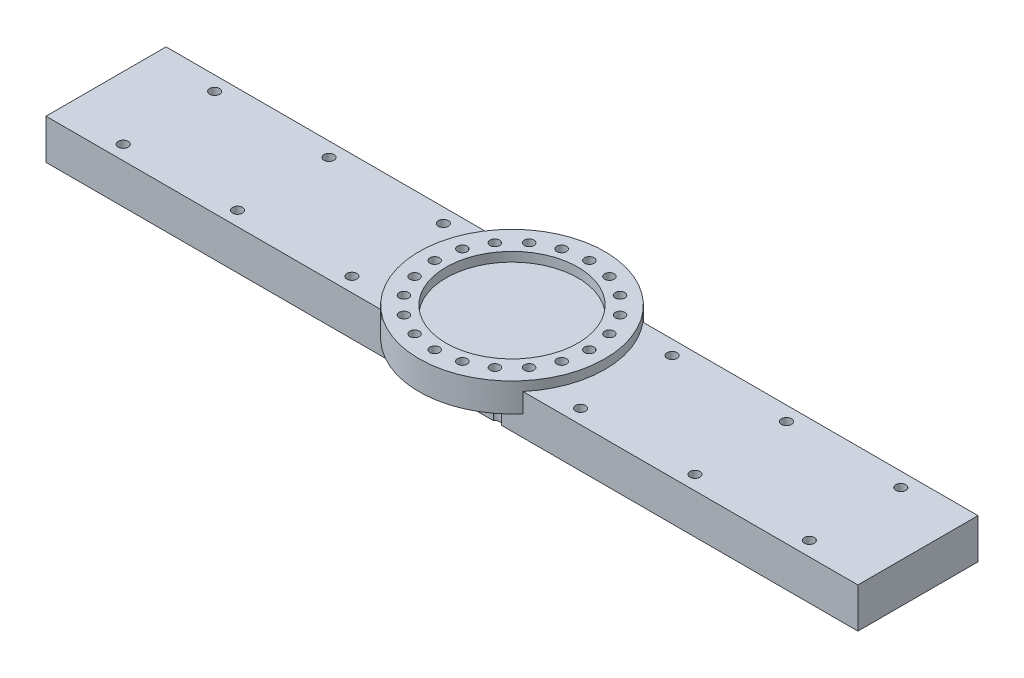
from build123d import *

# Parameters (mm, degrees)
SKETCH1_R                = 32.5
SKETCH1_R_2              = 1.675
BOSS_EXTRUDE1_DEPTH      = 10
SKETCH2_R                = 23.05
CUT_EXTRUDE1_DEPTH       = 3.25
BOSS_EXTRUDE2_DEPTH      = 7.25
BOSS_EXTRUDE2_DEPTH_BACK = 6.75
SKETCH3_W                = 284
SKETCH3_H                = 42
SKETCH3_R                = 1.75
CUT_EXTRUDE2_DEPTH       = 147.014554069
CUT_EXTRUDE2_DEPTH_BACK  = 147.014554069
SKETCH1_2_R              = 1.675


with BuildPart() as part:
    # Sketch1 → Boss-Extrude1 (new body)
    with BuildSketch(Plane(origin=(0, 0, 0), x_dir=(1, 0, 0), z_dir=(0, 1, 0))):
        Circle(SKETCH1_R)
        with Locations((15.899591075, 21.883909698)):
            Circle(SKETCH1_R_2, mode=Mode.SUBTRACT)
        with Locations((21.883909698, 15.899591075)):
            Circle(SKETCH1_R_2, mode=Mode.SUBTRACT)
        with Locations((25.726078766, 8.358909698)):
            Circle(SKETCH1_R_2, mode=Mode.SUBTRACT)
        with Locations((27.05, 0)):
            Circle(SKETCH1_R_2, mode=Mode.SUBTRACT)
        with Locations((25.726078766, -8.358909698)):
            Circle(SKETCH1_R_2, mode=Mode.SUBTRACT)
        with Locations((21.883909698, -15.899591075)):
            Circle(SKETCH1_R_2, mode=Mode.SUBTRACT)
        with Locations((15.899591075, -21.883909698)):
            Circle(SKETCH1_R_2, mode=Mode.SUBTRACT)
        with Locations((8.358909698, -25.726078766)):
            Circle(SKETCH1_R_2, mode=Mode.SUBTRACT)
        with Locations((0, -27.05)):
            Circle(SKETCH1_R_2, mode=Mode.SUBTRACT)
        with Locations((-8.358909698, -25.726078766)):
            Circle(SKETCH1_R_2, mode=Mode.SUBTRACT)
        with Locations((-15.899591075, -21.883909698)):
            Circle(SKETCH1_R_2, mode=Mode.SUBTRACT)
        with Locations((-21.883909698, -15.899591075)):
            Circle(SKETCH1_R_2, mode=Mode.SUBTRACT)
        with Locations((-25.726078766, -8.358909698)):
            Circle(SKETCH1_R_2, mode=Mode.SUBTRACT)
        with Locations((-27.05, 0)):
            Circle(SKETCH1_R_2, mode=Mode.SUBTRACT)
        with Locations((-25.726078766, 8.358909698)):
            Circle(SKETCH1_R_2, mode=Mode.SUBTRACT)
        with Locations((-21.883909698, 15.899591075)):
            Circle(SKETCH1_R_2, mode=Mode.SUBTRACT)
        with Locations((-15.899591075, 21.883909698)):
            Circle(SKETCH1_R_2, mode=Mode.SUBTRACT)
        with Locations((-8.358909698, 25.726078766)):
            Circle(SKETCH1_R_2, mode=Mode.SUBTRACT)
        with Locations((0, 27.05)):
            Circle(SKETCH1_R_2, mode=Mode.SUBTRACT)
        with Locations((8.358909698, 25.726078766)):
            Circle(SKETCH1_R_2, mode=Mode.SUBTRACT)
    extrude(amount=BOSS_EXTRUDE1_DEPTH)

    # Sketch2 → Cut-Extrude1 (cut)
    with BuildSketch(Plane(origin=(0, 10, 0), x_dir=(1, 0, 0), z_dir=(0, 1, 0))):
        Circle(SKETCH2_R)
    extrude(amount=-CUT_EXTRUDE1_DEPTH, mode=Mode.SUBTRACT)

    # Sketch3 → Boss-Extrude2 (add, two sides: drawn at the far end of the back side and taken through both)
    with BuildSketch(Plane.XZ.offset(-BOSS_EXTRUDE2_DEPTH_BACK)):
        Rectangle(SKETCH3_W, SKETCH3_H)
        with Locations((-120, 16)):
            Circle(SKETCH3_R, mode=Mode.SUBTRACT)
        with Locations((-80, 16)):
            Circle(SKETCH3_R, mode=Mode.SUBTRACT)
        with Locations((-40, 16)):
            Circle(SKETCH3_R, mode=Mode.SUBTRACT)
        with Locations((0, 16)):
            Circle(SKETCH3_R, mode=Mode.SUBTRACT)
        with Locations((40, 16)):
            Circle(SKETCH3_R, mode=Mode.SUBTRACT)
        with Locations((80, 16)):
            Circle(SKETCH3_R, mode=Mode.SUBTRACT)
        with Locations((120, 16)):
            Circle(SKETCH3_R, mode=Mode.SUBTRACT)
        with Locations((120, -16)):
            Circle(SKETCH3_R, mode=Mode.SUBTRACT)
        with Locations((80, -16)):
            Circle(SKETCH3_R, mode=Mode.SUBTRACT)
        with Locations((40, -16)):
            Circle(SKETCH3_R, mode=Mode.SUBTRACT)
        with Locations((0, -16)):
            Circle(SKETCH3_R, mode=Mode.SUBTRACT)
        with Locations((-40, -16)):
            Circle(SKETCH3_R, mode=Mode.SUBTRACT)
        with Locations((-80, -16)):
            Circle(SKETCH3_R, mode=Mode.SUBTRACT)
        with Locations((-120, -16)):
            Circle(SKETCH3_R, mode=Mode.SUBTRACT)
    extrude(amount=BOSS_EXTRUDE2_DEPTH + BOSS_EXTRUDE2_DEPTH_BACK)

    # Sketch1<2> → Cut-Extrude2 (cut, two sides: drawn at the far end of the back side and taken through both)
    with BuildSketch(Plane(origin=(0, 0, 0), x_dir=(1, 0, 0), z_dir=(0, 1, 0)).offset(-CUT_EXTRUDE2_DEPTH_BACK)):
        with Locations((15.899591075, 21.883909698)):
            Circle(SKETCH1_2_R)
        with Locations((21.883909698, 15.899591075)):
            Circle(SKETCH1_2_R)
        with Locations((25.726078766, 8.358909698)):
            Circle(SKETCH1_2_R)
        with Locations((27.05, 0)):
            Circle(SKETCH1_2_R)
        with Locations((25.726078766, -8.358909698)):
            Circle(SKETCH1_2_R)
        with Locations((21.883909698, -15.899591075)):
            Circle(SKETCH1_2_R)
        with Locations((15.899591075, -21.883909698)):
            Circle(SKETCH1_2_R)
        with Locations((8.358909698, -25.726078766)):
            Circle(SKETCH1_2_R)
        with Locations((0, -27.05)):
            Circle(SKETCH1_2_R)
        with Locations((-8.358909698, -25.726078766)):
            Circle(SKETCH1_2_R)
        with Locations((-15.899591075, -21.883909698)):
            Circle(SKETCH1_2_R)
        with Locations((-21.883909698, -15.899591075)):
            Circle(SKETCH1_2_R)
        with Locations((-25.726078766, -8.358909698)):
            Circle(SKETCH1_2_R)
        with Locations((-27.05, 0)):
            Circle(SKETCH1_2_R)
        with Locations((-25.726078766, 8.358909698)):
            Circle(SKETCH1_2_R)
        with Locations((-21.883909698, 15.899591075)):
            Circle(SKETCH1_2_R)
        with Locations((-15.899591075, 21.883909698)):
            Circle(SKETCH1_2_R)
        with Locations((-8.358909698, 25.726078766)):
            Circle(SKETCH1_2_R)
        with Locations((0, 27.05)):
            Circle(SKETCH1_2_R)
        with Locations((8.358909698, 25.726078766)):
            Circle(SKETCH1_2_R)
    extrude(amount=CUT_EXTRUDE2_DEPTH + CUT_EXTRUDE2_DEPTH_BACK, mode=Mode.SUBTRACT)


solid = part.part
